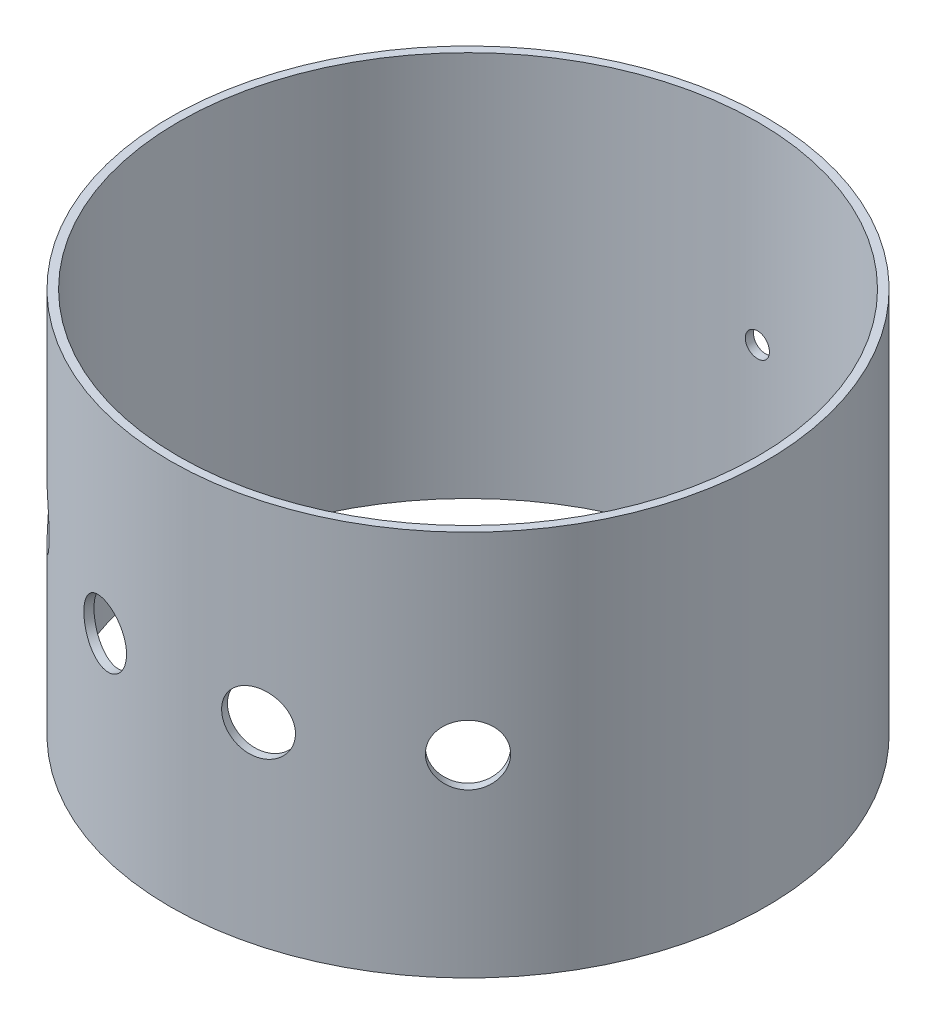
from build123d import *

# Parameters (mm, degrees)
BODY_TUBE_PROFILE_R        = 78.359
BODY_TUBE_PROFILE_R_2      = 76.2
BODY_TUBE_EXTRUSTION_DEPTH = 101.6
SKETCH2_R                  = 7.9375
KEY_HOLE_CUT_DEPTH         = 151.342361835
KEY_HOLE_PATTERN_COUNT     = 4
KEY_HOLE_PATTERN_ANGLE     = 90
SKETCH3_R                  = 3.175
CUT_EXTRUDE1_DEPTH         = 151.342362006


with BuildPart() as part:
    # Body Tube Profile → Body Tube Extrustion (new body)
    with BuildSketch(Plane(origin=(0, 0, 0), x_dir=(1, 0, 0), z_dir=(0, 1, 0))):
        Circle(BODY_TUBE_PROFILE_R)
        Circle(BODY_TUBE_PROFILE_R_2, mode=Mode.SUBTRACT)
    extrude(amount=BODY_TUBE_EXTRUSTION_DEPTH)

    # Sketch2 → Key Hole Cut (cut, through all)
    with BuildSketch(Plane(origin=(0, 0, 0), x_dir=(0, 1, 0), z_dir=(0.7071067811865488, 0, 0.7071067811865464))):
        with Locations((50.8, 0)):
            Circle(SKETCH2_R)
    key_hole_cut = extrude(amount=KEY_HOLE_CUT_DEPTH, mode=Mode.SUBTRACT)

    # Key Hole Pattern: Key Hole Cut ×4 about axis
    key_hole_pattern_axis = Axis((0, 101.6, 0), (0, -1, 0))
    for i in range(1, KEY_HOLE_PATTERN_COUNT):
        add(key_hole_cut.rotate(key_hole_pattern_axis, i * KEY_HOLE_PATTERN_ANGLE / (KEY_HOLE_PATTERN_COUNT - 1)), mode=Mode.SUBTRACT)

    # Sketch3 → Cut-Extrude1 (cut, through all)
    with BuildSketch(Plane.XY):
        with Locations((0, 50.8)):
            Circle(SKETCH3_R)
    extrude(amount=-CUT_EXTRUDE1_DEPTH, mode=Mode.SUBTRACT)


solid = part.part
